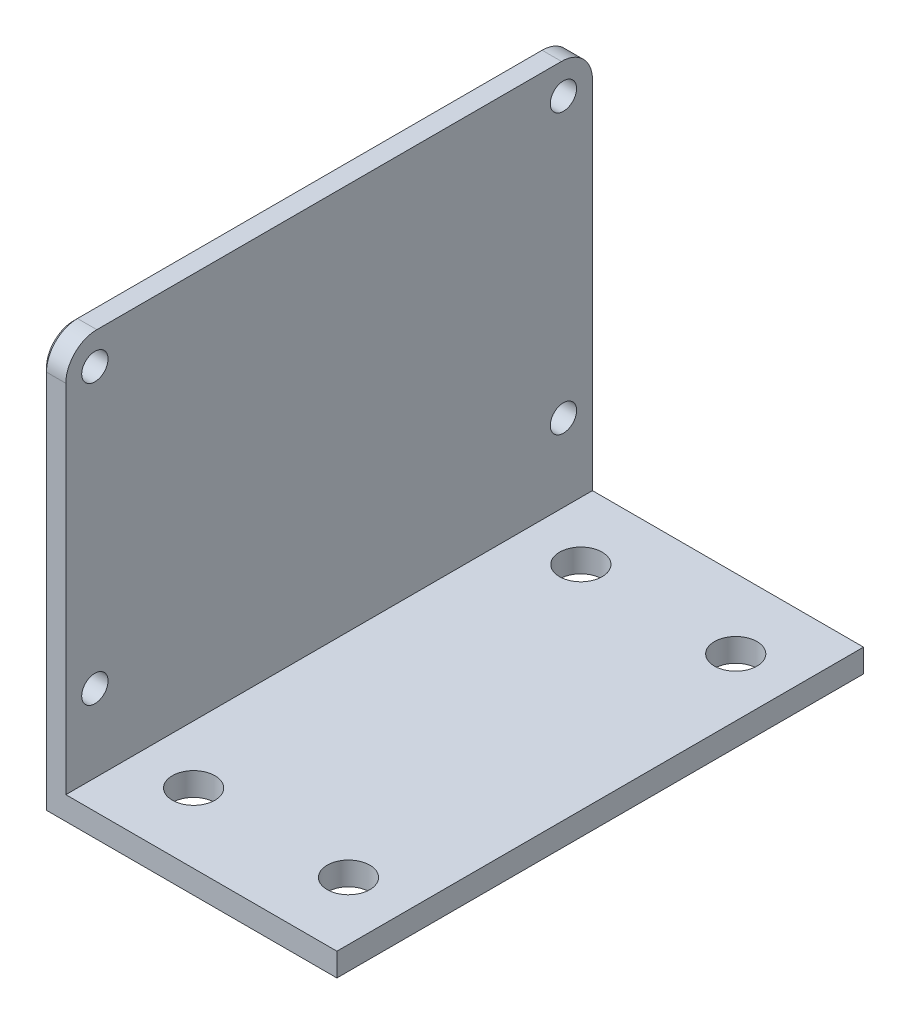
from build123d import *

# Parameters (mm, degrees)
BOSS_EXTRUDE1_DEPTH      = 68
M3_CLEARANCE_HOLE1_D     = 3.4
M3_CLEARANCE_HOLE1_DEPTH = 5
M3_CLEARANCE_HOLE1_TIP   = 1.021463052
M5_CLEARANCE_HOLE1_D     = 5.5
M5_CLEARANCE_HOLE1_DEPTH = 5
M5_CLEARANCE_HOLE1_TIP   = 1.652366702
FILLET1_R                = 4
CHAMFER1_SIZE            = 0.5


with BuildPart() as part:
    # Sketch1 → Boss-Extrude1 (new body)
    with BuildSketch(Plane.XY):
        Polygon((0, 0), (38, 0), (38, 3), (3, 3), (3, 53), (0, 53), align=None)
    extrude(amount=BOSS_EXTRUDE1_DEPTH)

    # M3 Clearance Hole1
    with Locations(Plane(origin=(3, 0, 0), x_dir=(0, 0, -1), z_dir=(1, 0, 0))):
        with Locations((-64.25, 49), (-3.75, 49), (-3.75, 13), (-64.25, 13)):
            Hole(M3_CLEARANCE_HOLE1_D / 2, depth=M3_CLEARANCE_HOLE1_DEPTH)
            with Locations((0, 0, -(M3_CLEARANCE_HOLE1_DEPTH + M3_CLEARANCE_HOLE1_TIP / 2))):  # 118° drill point
                Cone(0, M3_CLEARANCE_HOLE1_D / 2, M3_CLEARANCE_HOLE1_TIP, mode=Mode.SUBTRACT)

    # M5 Clearance Hole1
    with Locations(Plane(origin=(0, 3, 0), x_dir=(1, 0, 0), z_dir=(0, 1, 0))):
        with Locations((30.5, -59), (10.5, -59), (10.5, -9), (30.5, -9)):
            Hole(M5_CLEARANCE_HOLE1_D / 2, depth=M5_CLEARANCE_HOLE1_DEPTH)
            with Locations((0, 0, -(M5_CLEARANCE_HOLE1_DEPTH + M5_CLEARANCE_HOLE1_TIP / 2))):  # 118° drill point
                Cone(0, M5_CLEARANCE_HOLE1_D / 2, M5_CLEARANCE_HOLE1_TIP, mode=Mode.SUBTRACT)

    # Fillet1
    fillet1_edges = [part.edges().sort_by_distance(p)[0] for p in [
        (1.5, 53, 68),
        (1.5, 53, 0),
    ]]
    fillet(fillet1_edges, radius=FILLET1_R)

    # Chamfer1
    chamfer1_edges = [part.edges().sort_by_distance(p)[0] for p in [
        (0, 24.5, 68),
        (0, 51.828427125, 66.828427125),
        (0, 53, 34),
        (0, 51.828427125, 1.171572875),
        (0, 24.5, 0),
    ]]
    chamfer(chamfer1_edges, length=CHAMFER1_SIZE)


solid = part.part
